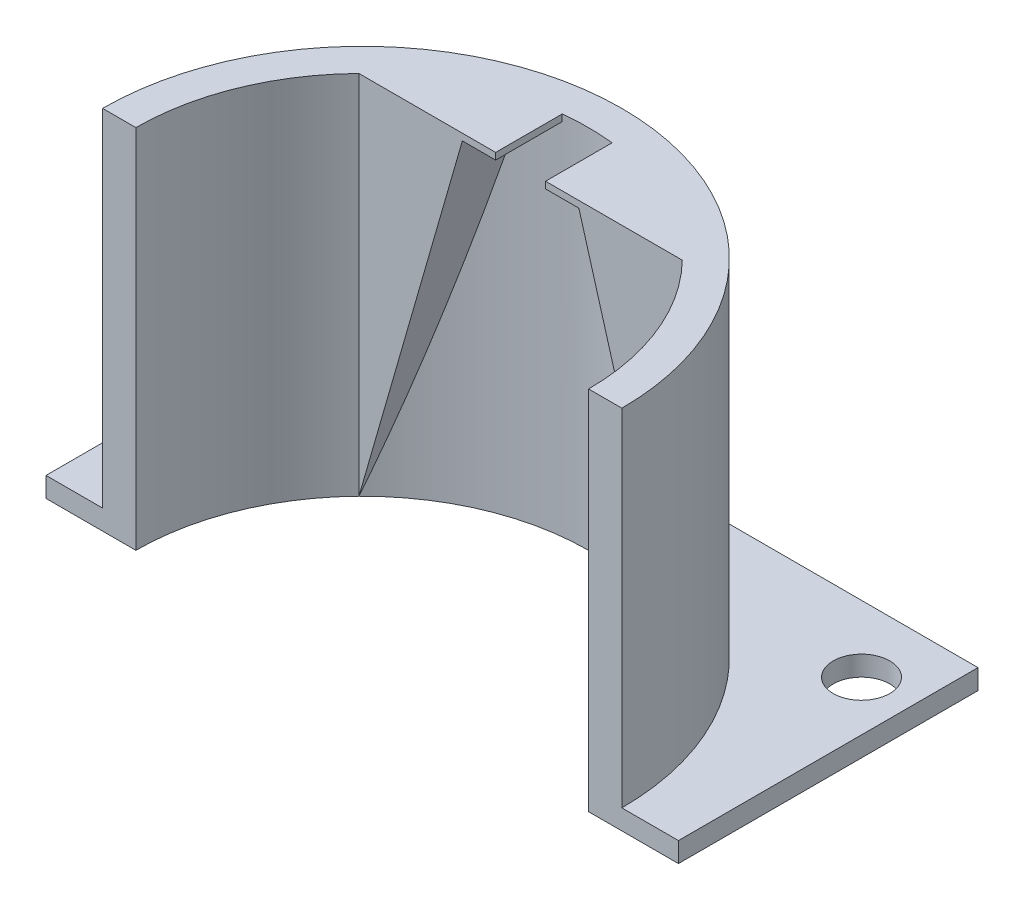
from build123d import *

# Parameters (mm, degrees)
BOSS_EXTRUDE1_DEPTH     = 55
CUT_EXTRUDE1_DEPTH      = 52
SKETCH3_R               = 4.25
CUT_EXTRUDE2_DEPTH      = 5
BOSS_EXTRUDE2_START     = -55
BOSS_EXTRUDE2_DEPTH     = 55
CUT_EXTRUDE3_REACH      = 78.468
CUT_EXTRUDE3_END_RADIUS = 34
SKETCH5_W               = 5
SKETCH5_H               = 54
CUT_EXTRUDE4_REACH      = 78.468
CUT_EXTRUDE4_END_RADIUS = 34


with BuildPart() as part:
    # Sketch1 → Boss-Extrude1 (new body)
    with BuildSketch(Plane(origin=(0, 0, 0), x_dir=(1, 0, 0), z_dir=(0, 1, 0))):
        with BuildLine():
            Line((-47.5, 0), (47.5, 0))
            Line((47.5, 0), (47.5, -45))
            Line((47.5, -45), (34, -45))
            ThreePointArc((34, -45), (0, -11), (-34, -45))
            Line((-34, -45), (-47.5, -45))
            Line((-47.5, -45), (-47.5, 0))
        make_face()
    extrude(amount=BOSS_EXTRUDE1_DEPTH)

    # Sketch2 → Cut-Extrude1 (cut)
    with BuildSketch(Plane(origin=(0, 55, 0), x_dir=(1, 0, 0), z_dir=(0, 1, 0))):
        with BuildLine():
            Line((-39, -45), (-47.5, -45))
            Line((-47.5, -45), (-47.5, 0))
            Line((-47.5, 0), (47.5, 0))
            Line((47.5, 0), (47.5, -45))
            Line((47.5, -45), (39, -45))
            ThreePointArc((39, -45), (0, -6), (-39, -45))
        make_face()
    extrude(amount=-CUT_EXTRUDE1_DEPTH, mode=Mode.SUBTRACT)

    # Sketch3 → Cut-Extrude2 (cut)
    with BuildSketch(Plane(origin=(0, 3, 0), x_dir=(1, 0, 0), z_dir=(0, 1, 0))):
        with Locations((-40, -10)):
            Circle(SKETCH3_R)
        with Locations((40, -10)):
            Circle(SKETCH3_R)
    extrude(amount=-CUT_EXTRUDE2_DEPTH, mode=Mode.SUBTRACT)

    # Sketch4 → Boss-Extrude2 (add)
    with BuildSketch(Plane(origin=(0, 55, 0), x_dir=(1, 0, 0), z_dir=(0, 1, 0)).offset(BOSS_EXTRUDE2_START)):
        with BuildLine():
            Line((-24.288141448, -21.20743425), (-3.75, -21.20743425))
            Line((-3.75, -21.20743425), (-3.75, -11.20743425))
            ThreePointArc((-3.75, -11.20743425), (-14.88402983, -14.430969004), (-24.288141448, -21.20743425))
        make_face()
        with BuildLine():
            Line((3.75, -21.20743425), (3.75, -11.20743425))
            ThreePointArc((3.75, -11.20743425), (14.88402983, -14.430969004), (24.288141448, -21.20743425))
            Line((24.288141448, -21.20743425), (3.75, -21.20743425))
        make_face()
    extrude(amount=BOSS_EXTRUDE2_DEPTH)

    # Cut-Extrude3: up to this cylinder (the profile starts inside it)
    cut_extrude3_end = Plane(origin=(0, 27, 45), z_dir=(0, -1, 0)) * Cylinder(CUT_EXTRUDE3_END_RADIUS, 225.936, mode=Mode.PRIVATE)
    # Sketch5 → Cut-Extrude3 (cut, up to the surface)
    with BuildSketch(Plane.XY.offset(21.20743425), mode=Mode.PRIVATE) as cut_extrude3_sk1:
        with Locations((-6.25, 27)):
            Rectangle(SKETCH5_W, SKETCH5_H)
    cut_extrude3_tool1 = extrude(cut_extrude3_sk1.sketch, amount=-CUT_EXTRUDE3_REACH, mode=Mode.PRIVATE) & cut_extrude3_end
    add(cut_extrude3_tool1.solids().sort_by_distance((-6.25, 27, 21.207434))[0], mode=Mode.SUBTRACT)
    # Sketch5 → Cut-Extrude3 (cut, up to the surface)
    with BuildSketch(Plane.XY.offset(21.20743425), mode=Mode.PRIVATE) as cut_extrude3_sk2:
        with Locations((6.25, 27)):
            Rectangle(SKETCH5_W, SKETCH5_H)
    cut_extrude3_tool2 = extrude(cut_extrude3_sk2.sketch, amount=-CUT_EXTRUDE3_REACH, mode=Mode.PRIVATE) & cut_extrude3_end
    add(cut_extrude3_tool2.solids().sort_by_distance((6.25, 27, 21.207434))[0], mode=Mode.SUBTRACT)

    # Cut-Extrude4: up to this cylinder (the profile starts inside it)
    cut_extrude4_end = Plane(origin=(0, 18, 45), z_dir=(0, -1, 0)) * Cylinder(CUT_EXTRUDE4_END_RADIUS, 225.936, mode=Mode.PRIVATE)
    # Sketch8 → Cut-Extrude4 (cut, up to the surface)
    with BuildSketch(Plane.XY.offset(21.20743425), mode=Mode.PRIVATE) as cut_extrude4_sk1:
        Polygon((-8.75, 54), (-24.288141448, 0), (-8.75, 0), align=None)
    cut_extrude4_tool1 = extrude(cut_extrude4_sk1.sketch, amount=-CUT_EXTRUDE4_REACH, mode=Mode.PRIVATE) & cut_extrude4_end
    add(cut_extrude4_tool1.solids().sort_by_distance((-13.92938, 18, 21.207434))[0], mode=Mode.SUBTRACT)
    # Sketch8 → Cut-Extrude4 (cut, up to the surface)
    with BuildSketch(Plane.XY.offset(21.20743425), mode=Mode.PRIVATE) as cut_extrude4_sk2:
        Polygon((24.288141448, 0), (8.75, 0), (8.75, 54), align=None)
    cut_extrude4_tool2 = extrude(cut_extrude4_sk2.sketch, amount=-CUT_EXTRUDE4_REACH, mode=Mode.PRIVATE) & cut_extrude4_end
    add(cut_extrude4_tool2.solids().sort_by_distance((13.92938, 18, 21.207434))[0], mode=Mode.SUBTRACT)


solid = part.part
